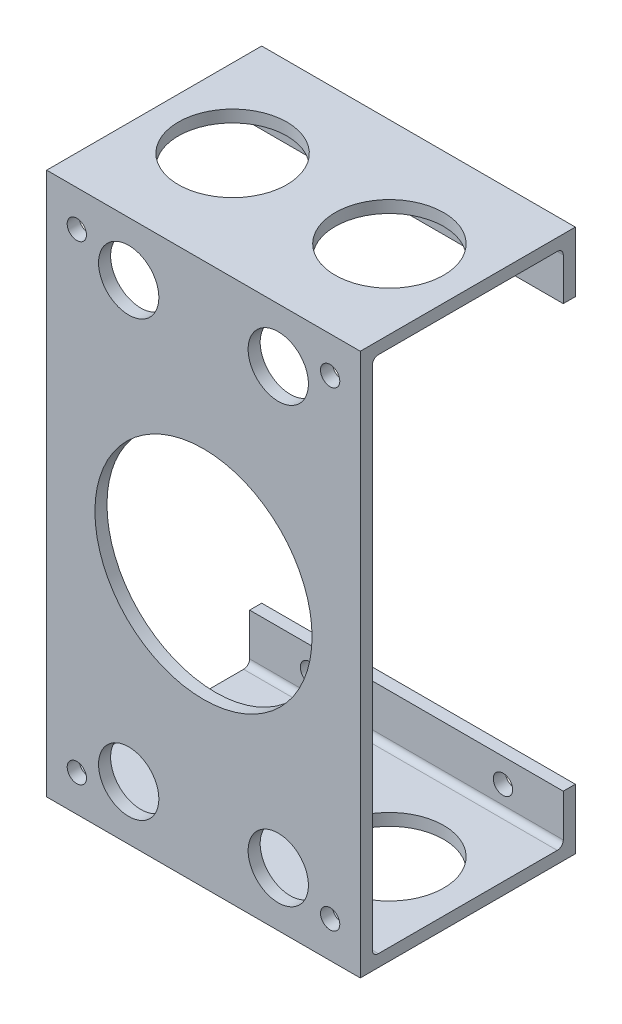
from build123d import *

# Parameters (mm, degrees)
BOSS_EXTRUDE1_DEPTH = 26
CUT_EXTRUDE1_REACH  = 65.026
SKETCH2_R           = 1.6
CUT_EXTRUDE2_REACH  = 65.026
SKETCH3_R           = 18
SKETCH4_R           = 9
CUT_EXTRUDE3_DEPTH  = 101.235919687
CUT_EXTRUDE4_REACH  = 65.026
SKETCH5_R           = 5
CUT_EXTRUDE5_REACH  = 63.916
SKETCH6_R           = 1.6
FILLET1_R           = 1


with BuildPart() as part:
    # Sketch1 → Boss-Extrude1 (new, symmetric)
    with BuildSketch(Plane(origin=(0, 0, 0), x_dir=(0, 0, -1), z_dir=(1, 0, 0))):
        Polygon((0, -45), (0, 45), (35.654447066, 45), (35.654447066, 35), (33.654447066, 35), (33.654447066, 43), (2, 43), (2, -43), (33.654447066, -43), (33.654447066, -35), (35.654447066, -35), (35.654447066, -45), align=None)
    extrude(amount=BOSS_EXTRUDE1_DEPTH, both=True)

    # Sketch2 → Cut-Extrude1 (cut, up to next)
    with BuildSketch(Plane.XY, mode=Mode.PRIVATE) as cut_extrude1_sk1:
        with Locations((-21, -39)):
            Circle(SKETCH2_R)
    cut_extrude1_tool1 = extrude(cut_extrude1_sk1.sketch, amount=-CUT_EXTRUDE1_REACH, mode=Mode.PRIVATE) & part.part
    # Sketch2 → Cut-Extrude1 (cut, up to next)
    with BuildSketch(Plane.XY, mode=Mode.PRIVATE) as cut_extrude1_sk2:
        with Locations((-21, 39)):
            Circle(SKETCH2_R)
    cut_extrude1_tool2 = extrude(cut_extrude1_sk2.sketch, amount=-CUT_EXTRUDE1_REACH, mode=Mode.PRIVATE) & part.part
    # Sketch2 → Cut-Extrude1 (cut, up to next)
    with BuildSketch(Plane.XY, mode=Mode.PRIVATE) as cut_extrude1_sk3:
        with Locations((21, 39)):
            Circle(SKETCH2_R)
    cut_extrude1_tool3 = extrude(cut_extrude1_sk3.sketch, amount=-CUT_EXTRUDE1_REACH, mode=Mode.PRIVATE) & part.part
    # Sketch2 → Cut-Extrude1 (cut, up to next)
    with BuildSketch(Plane.XY, mode=Mode.PRIVATE) as cut_extrude1_sk4:
        with Locations((21, -39)):
            Circle(SKETCH2_R)
    cut_extrude1_tool4 = extrude(cut_extrude1_sk4.sketch, amount=-CUT_EXTRUDE1_REACH, mode=Mode.PRIVATE) & part.part
    add(cut_extrude1_tool1.solids().sort_by_distance((-21, -39, 0))[0], mode=Mode.SUBTRACT)
    add(cut_extrude1_tool2.solids().sort_by_distance((-21, 39, 0))[0], mode=Mode.SUBTRACT)
    add(cut_extrude1_tool3.solids().sort_by_distance((21, 39, 0))[0], mode=Mode.SUBTRACT)
    add(cut_extrude1_tool4.solids().sort_by_distance((21, -39, 0))[0], mode=Mode.SUBTRACT)

    # Sketch3 → Cut-Extrude2 (cut, up to next)
    with BuildSketch(Plane.XY, mode=Mode.PRIVATE) as cut_extrude2_sk1:
        Circle(SKETCH3_R)
    cut_extrude2_tool1 = extrude(cut_extrude2_sk1.sketch, amount=-CUT_EXTRUDE2_REACH, mode=Mode.PRIVATE) & part.part
    add(cut_extrude2_tool1.solids().sort_by_distance((0, 0, 0))[0], mode=Mode.SUBTRACT)

    # Sketch4 → Cut-Extrude3 (cut, through all)
    with BuildSketch(Plane.XZ.offset(45)):
        with Locations((-13, -17.827223533)):
            Circle(SKETCH4_R)
        with Locations((13, -17.827223533)):
            Circle(SKETCH4_R)
    extrude(amount=-CUT_EXTRUDE3_DEPTH, mode=Mode.SUBTRACT)

    # Sketch5 → Cut-Extrude4 (cut, up to next)
    with BuildSketch(Plane.XY, mode=Mode.PRIVATE) as cut_extrude4_sk1:
        with Locations((-12.4, -36)):
            Circle(SKETCH5_R)
    cut_extrude4_tool1 = extrude(cut_extrude4_sk1.sketch, amount=-CUT_EXTRUDE4_REACH, mode=Mode.PRIVATE) & part.part
    # Sketch5 → Cut-Extrude4 (cut, up to next)
    with BuildSketch(Plane.XY, mode=Mode.PRIVATE) as cut_extrude4_sk2:
        with Locations((-12.4, 36)):
            Circle(SKETCH5_R)
    cut_extrude4_tool2 = extrude(cut_extrude4_sk2.sketch, amount=-CUT_EXTRUDE4_REACH, mode=Mode.PRIVATE) & part.part
    # Sketch5 → Cut-Extrude4 (cut, up to next)
    with BuildSketch(Plane.XY, mode=Mode.PRIVATE) as cut_extrude4_sk3:
        with Locations((12.4, 36)):
            Circle(SKETCH5_R)
    cut_extrude4_tool3 = extrude(cut_extrude4_sk3.sketch, amount=-CUT_EXTRUDE4_REACH, mode=Mode.PRIVATE) & part.part
    # Sketch5 → Cut-Extrude4 (cut, up to next)
    with BuildSketch(Plane.XY, mode=Mode.PRIVATE) as cut_extrude4_sk4:
        with Locations((12.4, -36)):
            Circle(SKETCH5_R)
    cut_extrude4_tool4 = extrude(cut_extrude4_sk4.sketch, amount=-CUT_EXTRUDE4_REACH, mode=Mode.PRIVATE) & part.part
    add(cut_extrude4_tool1.solids().sort_by_distance((-12.4, -36, 0))[0], mode=Mode.SUBTRACT)
    add(cut_extrude4_tool2.solids().sort_by_distance((-12.4, 36, 0))[0], mode=Mode.SUBTRACT)
    add(cut_extrude4_tool3.solids().sort_by_distance((12.4, 36, 0))[0], mode=Mode.SUBTRACT)
    add(cut_extrude4_tool4.solids().sort_by_distance((12.4, -36, 0))[0], mode=Mode.SUBTRACT)

    # Sketch6 → Cut-Extrude5 (cut, up to next)
    with BuildSketch(Plane.XY.offset(-33.654447066), mode=Mode.PRIVATE) as cut_extrude5_sk1:
        with Locations((16, -39)):
            Circle(SKETCH6_R)
    cut_extrude5_tool1 = extrude(cut_extrude5_sk1.sketch, amount=-CUT_EXTRUDE5_REACH, mode=Mode.PRIVATE) & part.part
    # Sketch6 → Cut-Extrude5 (cut, up to next)
    with BuildSketch(Plane.XY.offset(-33.654447066), mode=Mode.PRIVATE) as cut_extrude5_sk2:
        with Locations((-16, -39)):
            Circle(SKETCH6_R)
    cut_extrude5_tool2 = extrude(cut_extrude5_sk2.sketch, amount=-CUT_EXTRUDE5_REACH, mode=Mode.PRIVATE) & part.part
    # Sketch6 → Cut-Extrude5 (cut, up to next)
    with BuildSketch(Plane.XY.offset(-33.654447066), mode=Mode.PRIVATE) as cut_extrude5_sk3:
        with Locations((-16, 39)):
            Circle(SKETCH6_R)
    cut_extrude5_tool3 = extrude(cut_extrude5_sk3.sketch, amount=-CUT_EXTRUDE5_REACH, mode=Mode.PRIVATE) & part.part
    # Sketch6 → Cut-Extrude5 (cut, up to next)
    with BuildSketch(Plane.XY.offset(-33.654447066), mode=Mode.PRIVATE) as cut_extrude5_sk4:
        with Locations((16, 39)):
            Circle(SKETCH6_R)
    cut_extrude5_tool4 = extrude(cut_extrude5_sk4.sketch, amount=-CUT_EXTRUDE5_REACH, mode=Mode.PRIVATE) & part.part
    add(cut_extrude5_tool1.solids().sort_by_distance((16, -39, -33.654447))[0], mode=Mode.SUBTRACT)
    add(cut_extrude5_tool2.solids().sort_by_distance((-16, -39, -33.654447))[0], mode=Mode.SUBTRACT)
    add(cut_extrude5_tool3.solids().sort_by_distance((-16, 39, -33.654447))[0], mode=Mode.SUBTRACT)
    add(cut_extrude5_tool4.solids().sort_by_distance((16, 39, -33.654447))[0], mode=Mode.SUBTRACT)

    # Fillet1
    fillet1_edges = [part.edges().sort_by_distance(p)[0] for p in [
        (0, -43, -2),
        (0, 43, -2),
        (0, -43, -33.654447066),
        (0, 43, -33.654447066),
    ]]
    fillet(fillet1_edges, radius=FILLET1_R)


solid = part.part
